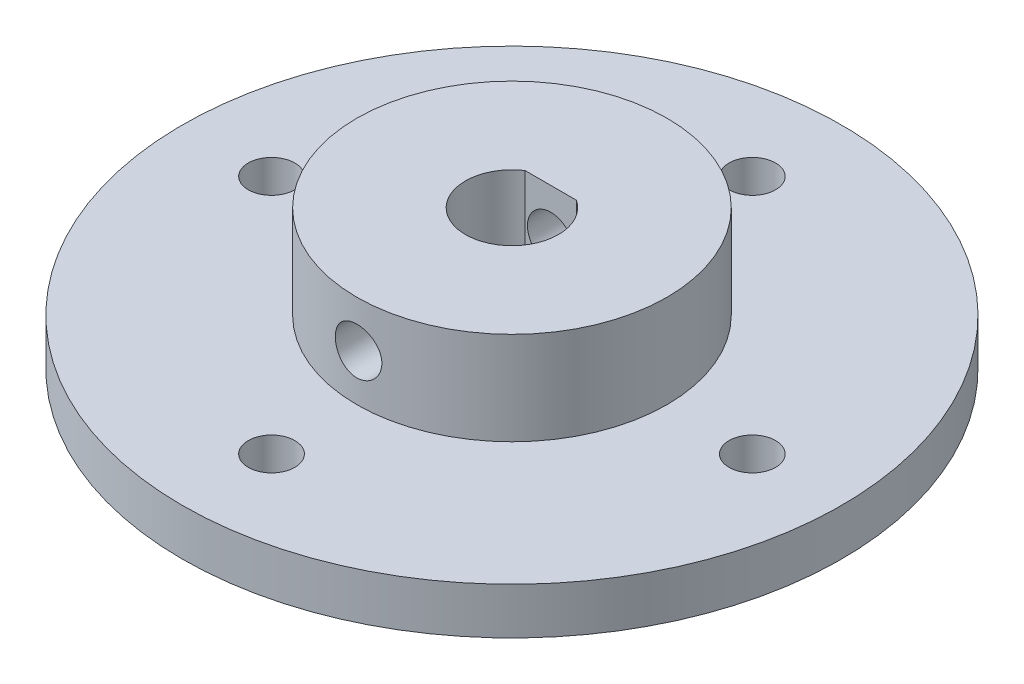
from build123d import *

# Parameters (mm, degrees)
SKETCH1_R               = 21.25
SKETCH1_R_2             = 1.5
BOSS_EXTRUDE1_DEPTH     = 3
BOSS_EXTRUDE2_START     = 6
SKETCH1_4_R             = 10
BOSS_EXTRUDE2_DEPTH     = 6
CUT_EXTRUDE1_DEPTH      = 33.428768093
CUT_EXTRUDE1_DEPTH_BACK = 33.428768093
SKETCH2_R               = 1.5


with BuildPart() as part:
    # Sketch1 → Boss-Extrude1 (new body)
    with BuildSketch(Plane(origin=(0, 0, 0), x_dir=(1, 0, 0), z_dir=(0, 1, 0))):
        Circle(SKETCH1_R)
        with Locations((0, -15.5)):
            Circle(SKETCH1_R_2, mode=Mode.SUBTRACT)
        with Locations((-15.5, 0)):
            Circle(SKETCH1_R_2, mode=Mode.SUBTRACT)
        with Locations((15.5, 0)):
            Circle(SKETCH1_R_2, mode=Mode.SUBTRACT)
        with Locations((0, 15.5)):
            Circle(SKETCH1_R_2, mode=Mode.SUBTRACT)
        with BuildLine():
            Line((-1.658312395, 2.5), (1.658312395, 2.5))
            ThreePointArc((1.658312395, 2.5), (0, -3), (-1.658312395, 2.5))
        make_face(mode=Mode.SUBTRACT)
    extrude(amount=-BOSS_EXTRUDE1_DEPTH)

    # Sketch1<4> → Boss-Extrude2 (add)
    with BuildSketch(Plane(origin=(0, 0, 0), x_dir=(1, 0, 0), z_dir=(0, 1, 0)).offset(BOSS_EXTRUDE2_START)):
        Circle(SKETCH1_4_R)
        with BuildLine():
            ThreePointArc((1.658312395, 2.5), (0, -3), (-1.658312395, 2.5))
            Line((-1.658312395, 2.5), (1.658312395, 2.5))
        make_face(mode=Mode.SUBTRACT)
    extrude(amount=-BOSS_EXTRUDE2_DEPTH)

    # Sketch2 → Cut-Extrude1 (cut, two sides: drawn at the far end of the back side and taken through both)
    with BuildSketch(Plane.XY.offset(-2.5).offset(-CUT_EXTRUDE1_DEPTH_BACK)):
        with Locations((0, 3)):
            Circle(SKETCH2_R)
    extrude(amount=CUT_EXTRUDE1_DEPTH + CUT_EXTRUDE1_DEPTH_BACK, mode=Mode.SUBTRACT)


solid = part.part
